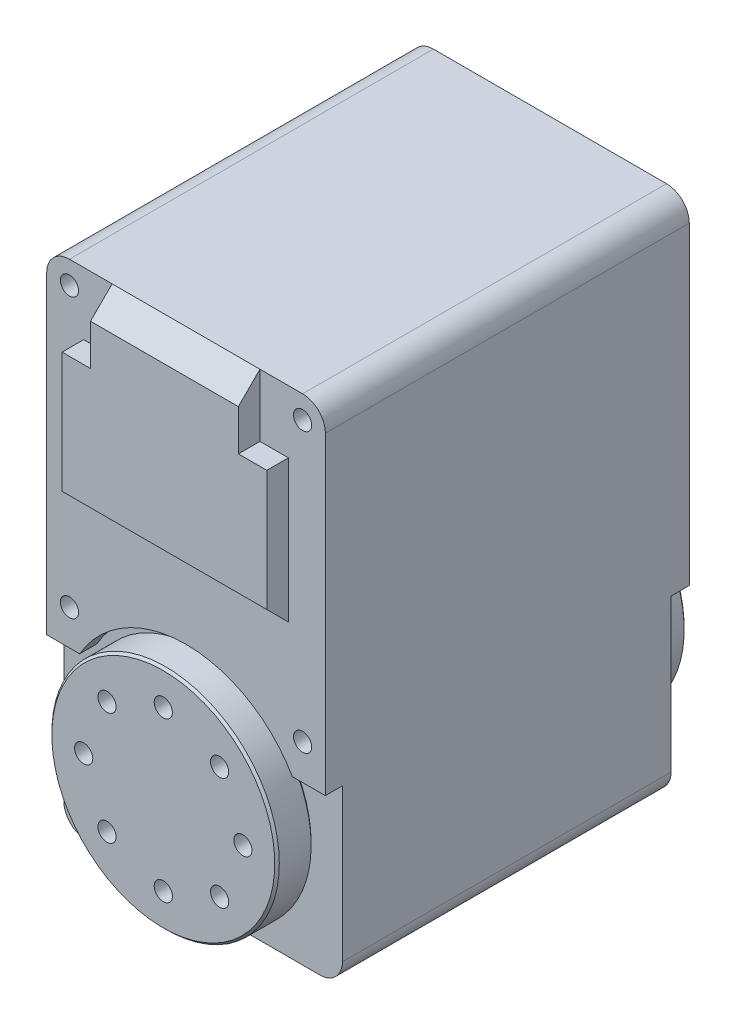
from build123d import *

# Parameters (mm, degrees)
BOSS_EXTRUDE1_DEPTH      = 32
CUT_EXTRUDE1_START       = -1.5
CUT_EXTRUDE1_DEPTH       = 1.5
SKETCH3_R                = 10.8
SKETCH3_W                = 24.5
SKETCH3_H                = 15.4
CUT_EXTRUDE2_DEPTH       = 1.6
BOSS_EXTRUDE2_DEPTH      = 0.3
BOSS_EXTRUDE2_DEPTH_BACK = 29.3
SKETCH4_R                = 3.2
SKETCH5_R                = 10
SKETCH5_R_2              = 0.8
BOSS_EXTRUDE3_DEPTH      = 3.2
BOSS_EXTRUDE5_START      = 3.2
SKETCH6_R                = 10
SKETCH6_R_2              = 0.8
BOSS_EXTRUDE5_DEPTH      = 3.2
BOSS_EXTRUDE6_DEPTH      = 1.9
CHAMFER1_SIZE            = 1.9
BOSS_EXTRUDE7_START      = 1.1
BOSS_EXTRUDE7_DEPTH      = 1.1
CHAMFER2_SIZE            = 1.1
SKETCH9_R                = 0.8
CUT_EXTRUDE3_DEPTH       = 3
CUT_EXTRUDE4_START       = -3
SKETCH10_R               = 0.8
CUT_EXTRUDE4_DEPTH       = 3
CHAMFER3_SIZE            = 0.2


with BuildPart() as part:
    # Sketch1 → Boss-Extrude1 (new body)
    with BuildSketch(Plane.XY):
        with BuildLine():
            Line((-10.25, 22.5), (10.25, 22.5))
            ThreePointArc((10.25, 22.5), (11.664213562, 21.914213562), (12.25, 20.5))
            Line((12.25, 20.5), (12.25, -20.5))
            ThreePointArc((12.25, -20.5), (11.664213562, -21.914213562), (10.25, -22.5))
            Line((10.25, -22.5), (-10.25, -22.5))
            ThreePointArc((-10.25, -22.5), (-11.664213562, -21.914213562), (-12.25, -20.5))
            Line((-12.25, -20.5), (-12.25, 20.5))
            ThreePointArc((-12.25, 20.5), (-11.664213562, 21.914213562), (-10.25, 22.5))
        make_face()
    extrude(amount=BOSS_EXTRUDE1_DEPTH)

    # Sketch2 → Cut-Extrude1 (cut)
    with BuildSketch(Plane.XY.offset(32).offset(CUT_EXTRUDE1_START)):
        with BuildLine():
            ThreePointArc((9.353074361, -7.1), (0, -1.7), (-9.353074361, -7.1))
            Line((-9.353074361, -7.1), (9.353074361, -7.1))
        make_face()
        with BuildLine():
            Line((9.353074361, -7.1), (-9.353074361, -7.1))
            ThreePointArc((-9.353074361, -7.1), (-10.217465609, -15.99905652), (-4.079215611, -22.5))
            Line((-4.079215611, -22.5), (4.079215611, -22.5))
            ThreePointArc((4.079215611, -22.5), (8.963691444, -18.524303752), (10.8, -12.5))
            ThreePointArc((10.8, -12.5), (10.431998924, -9.704754313), (9.353074361, -7.1))
        make_face()
        with BuildLine():
            Line((12.25, -7.1), (9.353074361, -7.1))
            ThreePointArc((9.353074361, -7.1), (10.431998924, -9.704754313), (10.8, -12.5))
            ThreePointArc((10.8, -12.5), (8.963691444, -18.524303752), (4.079215611, -22.5))
            Line((4.079215611, -22.5), (10.25, -22.5))
            ThreePointArc((10.25, -22.5), (11.664213562, -21.914213562), (12.25, -20.5))
            Line((12.25, -20.5), (12.25, -7.1))
        make_face()
        with BuildLine():
            Line((-9.353074361, -7.1), (-12.25, -7.1))
            Line((-12.25, -7.1), (-12.25, -20.5))
            ThreePointArc((-12.25, -20.5), (-11.664213562, -21.914213562), (-10.25, -22.5))
            Line((-10.25, -22.5), (-4.079215611, -22.5))
            ThreePointArc((-4.079215611, -22.5), (-10.217465609, -15.99905652), (-9.353074361, -7.1))
        make_face()
    extrude(amount=CUT_EXTRUDE1_DEPTH, mode=Mode.SUBTRACT)

    # Sketch3 → Cut-Extrude2 (cut)
    with BuildSketch(Plane(origin=(0, 0, 0), x_dir=(-1, 0, 0), z_dir=(0, 0, -1))):
        with Locations((0, -12.5)):
            Circle(SKETCH3_R)
        with Locations((0, -14.8)):
            Rectangle(SKETCH3_W, SKETCH3_H)
    extrude(amount=-CUT_EXTRUDE2_DEPTH, mode=Mode.SUBTRACT)

    # Sketch4 → Boss-Extrude2 (add, two sides: drawn at the far end of the back side and taken through both)
    with BuildSketch(Plane.XY.offset(30.5).offset(-BOSS_EXTRUDE2_DEPTH_BACK)):
        with Locations((0, -12.5)):
            Circle(SKETCH4_R)
    extrude(amount=BOSS_EXTRUDE2_DEPTH + BOSS_EXTRUDE2_DEPTH_BACK)

    # Sketch5 → Boss-Extrude3 (add)
    with BuildSketch(Plane.XY.offset(30.8)):
        with Locations((0, -12.5)):
            Circle(SKETCH5_R)
        with Locations((0, -5.5)):
            Circle(SKETCH5_R_2, mode=Mode.SUBTRACT)
        with Locations((4.949747468, -7.550252532)):
            Circle(SKETCH5_R_2, mode=Mode.SUBTRACT)
        with Locations((7, -12.5)):
            Circle(SKETCH5_R_2, mode=Mode.SUBTRACT)
        with Locations((4.949747468, -17.449747468)):
            Circle(SKETCH5_R_2, mode=Mode.SUBTRACT)
        with Locations((0, -19.5)):
            Circle(SKETCH5_R_2, mode=Mode.SUBTRACT)
        with Locations((-4.949747468, -17.449747468)):
            Circle(SKETCH5_R_2, mode=Mode.SUBTRACT)
        with Locations((-7, -12.5)):
            Circle(SKETCH5_R_2, mode=Mode.SUBTRACT)
        with Locations((-4.949747468, -7.550252532)):
            Circle(SKETCH5_R_2, mode=Mode.SUBTRACT)
    extrude(amount=BOSS_EXTRUDE3_DEPTH)

    # Sketch6 → Boss-Extrude5 (add)
    with BuildSketch(Plane(origin=(0, 0, 1.2), x_dir=(-1, 0, 0), z_dir=(0, 0, -1)).offset(BOSS_EXTRUDE5_START)):
        with Locations(Location((0, -12.5, 0), (0, 0, 180))):
            Circle(SKETCH6_R)
        with Locations(Location((0, -5.5, 0), (0, 0, 180))):
            Circle(SKETCH6_R_2, mode=Mode.SUBTRACT)
        with Locations(Location((4.949747468, -7.550252532, 0), (0, 0, 180))):
            Circle(SKETCH6_R_2, mode=Mode.SUBTRACT)
        with Locations(Location((7, -12.5, 0), (0, 0, 180))):
            Circle(SKETCH6_R_2, mode=Mode.SUBTRACT)
        with Locations(Location((4.949747468, -17.449747468, 0), (0, 0, 180))):
            Circle(SKETCH6_R_2, mode=Mode.SUBTRACT)
        with Locations(Location((0, -19.5, 0), (0, 0, 180))):
            Circle(SKETCH6_R_2, mode=Mode.SUBTRACT)
        with Locations(Location((-4.949747468, -17.449747468, 0), (0, 0, 180))):
            Circle(SKETCH6_R_2, mode=Mode.SUBTRACT)
        with Locations(Location((-7, -12.5, 0), (0, 0, 180))):
            Circle(SKETCH6_R_2, mode=Mode.SUBTRACT)
        with Locations(Location((-4.949747468, -7.550252532, 0), (0, 0, 180))):
            Circle(SKETCH6_R_2, mode=Mode.SUBTRACT)
    extrude(amount=-BOSS_EXTRUDE5_DEPTH)

    # Sketch7 → Boss-Extrude6 (add)
    with BuildSketch(Plane.XY.offset(32)):
        Polygon((6.5, 22.5), (-6.5, 22.5), (-6.5, 17), (-9, 17), (-9, 4.5), (9, 4.5), (9, 17), (6.5, 17), align=None)
    extrude(amount=BOSS_EXTRUDE6_DEPTH)

    # Chamfer1
    chamfer1_edges = [part.edges().sort_by_distance(p)[0] for p in [
        (0, 22.5, 33.9),
        (0, 4.5, 33.9),
    ]]
    chamfer(chamfer1_edges, length=CHAMFER1_SIZE - 0.0001)  # a hair under: the kernel refuses the full size

    # Sketch8 → Boss-Extrude7 (add)
    with BuildSketch(Plane(origin=(0, 0, 0), x_dir=(-1, 0, 0), z_dir=(0, 0, -1)).offset(BOSS_EXTRUDE7_START)):
        with BuildLine():
            Line((7, 22.5), (-7, 22.5))
            Line((-7, 22.5), (-7, -4.275645922))
            ThreePointArc((-7, -4.275645922), (0, -1.7), (7, -4.275645922))
            Line((7, -4.275645922), (7, 22.5))
        make_face()
    extrude(amount=-BOSS_EXTRUDE7_DEPTH)

    # Chamfer2
    chamfer2_edges = [part.edges().sort_by_distance(p)[0] for p in [
        (0, 22.5, -1.1),
    ]]
    chamfer(chamfer2_edges, length=CHAMFER2_SIZE)

    # Sketch9 → Cut-Extrude3 (cut)
    with BuildSketch(Plane.XY.offset(32)):
        with Locations((-10.25, 20.5)):
            Circle(SKETCH9_R)
        with Locations((10.25, 20.5)):
            Circle(SKETCH9_R)
        with Locations((-10.25, -4)):
            Circle(SKETCH9_R)
        with Locations((10.25, -4)):
            Circle(SKETCH9_R)
    extrude(amount=-CUT_EXTRUDE3_DEPTH, mode=Mode.SUBTRACT)

    # Sketch10 → Cut-Extrude4 (cut)
    with BuildSketch(Plane(origin=(0, 0, 0), x_dir=(-1, 0, 0), z_dir=(0, 0, -1)).offset(CUT_EXTRUDE4_START)):
        with Locations(Location((-10.25, 20.5, 0), (0, 0, 180))):
            Circle(SKETCH10_R)
        with Locations(Location((10.25, 20.5, 0), (0, 0, 180))):
            Circle(SKETCH10_R)
        with Locations(Location((-10.25, -4, 0), (0, 0, 180))):
            Circle(SKETCH10_R)
        with Locations(Location((10.25, -4, 0), (0, 0, 180))):
            Circle(SKETCH10_R)
    extrude(amount=CUT_EXTRUDE4_DEPTH, mode=Mode.SUBTRACT)

    # Chamfer3
    chamfer3_edges = [part.edges().sort_by_distance(p)[0] for p in [
        (-10, -12.5, -2),
        (-10, -12.5, 1.2),
        (-10, -12.5, 34),
        (-10, -12.5, 30.8),
    ]]
    chamfer(chamfer3_edges, length=CHAMFER3_SIZE)


solid = part.part
